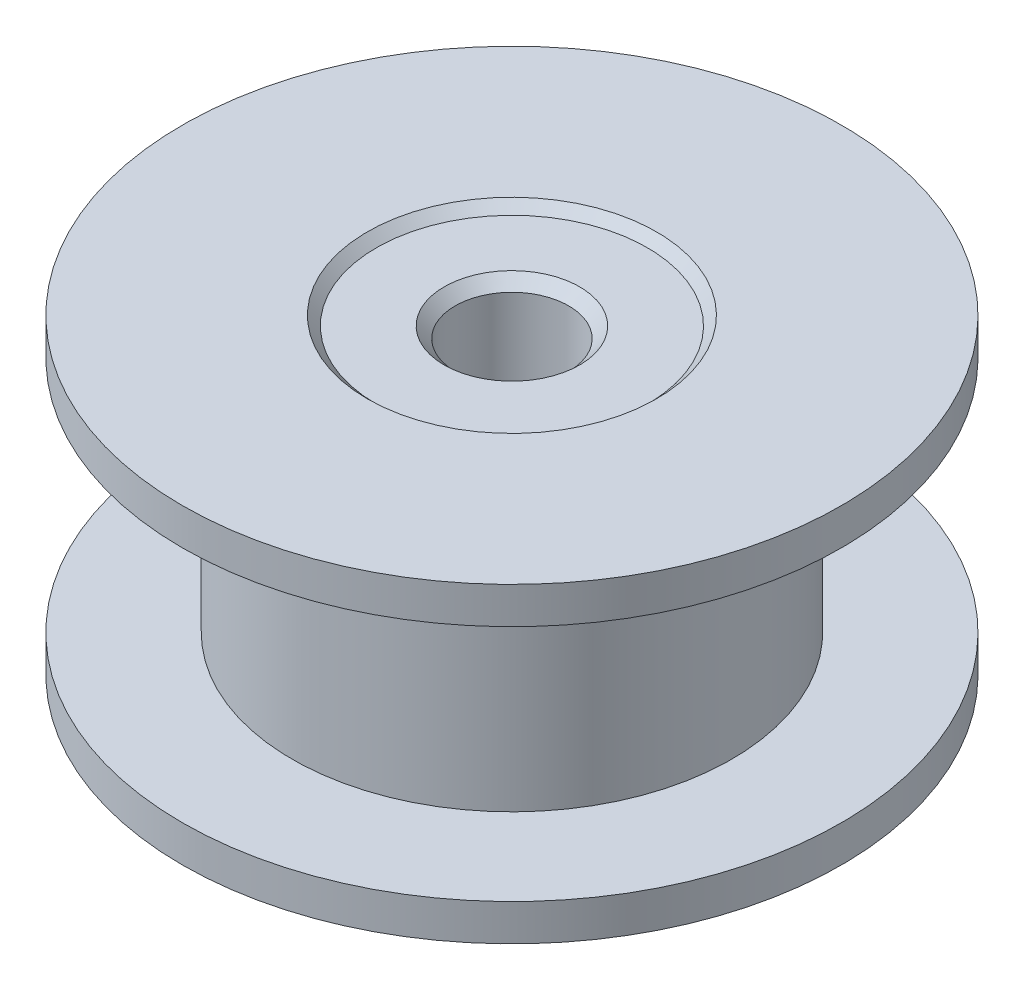
from build123d import *

# Parameters (mm, degrees)
SKETCH1_R           = 6
BOSS_EXTRUDE1_DEPTH = 3.25
SKETCH2_R           = 9
BOSS_EXTRUDE2_DEPTH = 1
SKETCH4_R           = 4
CUT_EXTRUDE1_DEPTH  = 16.305227865
SKETCH7_R           = 4
SKETCH7_R_2         = 1.55
BOSS_EXTRUDE4_DEPTH = 4
CHAMFER2_SIZE       = 0.3


with BuildPart() as part:
    # Sketch1 → Boss-Extrude1 (new, symmetric)
    with BuildSketch(Plane(origin=(0, 0, 0), x_dir=(1, 0, 0), z_dir=(0, 1, 0))):
        with Locations(Location((0, 0, 0), (0, 0, 90))):
            Circle(SKETCH1_R)
    extrude(amount=BOSS_EXTRUDE1_DEPTH, both=True)

    # Sketch2 → Boss-Extrude2 (add)
    with BuildSketch(Plane(origin=(0, 3.25, 0), x_dir=(1, 0, 0), z_dir=(0, 1, 0))):
        with Locations(Location((0, 0, 0), (0, 0, 270))):
            Circle(SKETCH2_R)
    boss_extrude2 = extrude(amount=BOSS_EXTRUDE2_DEPTH)

    # Mirror3: Boss-Extrude2 across plane
    add(boss_extrude2.mirror(Plane.ZX))

    # Sketch4 → Cut-Extrude1 (cut, through all)
    with BuildSketch(Plane.XZ.offset(4.25)):
        with Locations(Location((0, 0, 0), (0, 0, 270))):
            Circle(SKETCH4_R)
    extrude(amount=-CUT_EXTRUDE1_DEPTH, mode=Mode.SUBTRACT)

    # Sketch7 → Boss-Extrude4 (add, symmetric)
    with BuildSketch(Plane(origin=(0, 0, 0), x_dir=(1, 0, 0), z_dir=(0, 1, 0))):
        with Locations(Location((0, 0, 0), (0, 0, 90))):
            Circle(SKETCH7_R)
        with Locations(Location((0, 0, 0), (0, 0, 270))):
            Circle(SKETCH7_R_2, mode=Mode.SUBTRACT)
    extrude(amount=BOSS_EXTRUDE4_DEPTH, both=True)

    # Chamfer2
    # the kernel refuses this chamfer: 0.3 mm, written as the material it adds along each edge
    with BuildSketch(Plane(origin=(0, 4, 0), x_dir=(0, 0, -1), z_dir=(1, 0, 0))) as chamfer2_piece_1_section:
        Polygon((4 - CHAMFER2_SIZE, 0), (4, CHAMFER2_SIZE), (4, 0), align=None)
    chamfer2_piece_1 = revolve(axis=Axis((0, 4, 0), (0, 1, 0)), mode=Mode.PRIVATE)
    chamfer2_piece_1 = split(chamfer2_piece_1, bisect_by=Plane(origin=(0, 4.25, 3.828198445), z_dir=(0, -1, 0)), keep=Keep.TOP, mode=Mode.PRIVATE)
    add(chamfer2_piece_1)
    with BuildSketch(Plane(origin=(0, -4, 0), x_dir=(0, 0, -1), z_dir=(1, 0, 0))) as chamfer2_piece_2_section:
        Polygon((4, -CHAMFER2_SIZE), (4 - CHAMFER2_SIZE, 0), (4, 0), align=None)
    chamfer2_piece_2 = revolve(axis=Axis((0, -4, 0), (0, 1, 0)), mode=Mode.PRIVATE)
    chamfer2_piece_2 = split(chamfer2_piece_2, bisect_by=Plane(origin=(0, -4.25, 3.828198445), z_dir=(0, 1, 0)), keep=Keep.TOP, mode=Mode.PRIVATE)
    add(chamfer2_piece_2)
    # the kernel refuses this chamfer: 0.3 mm, written as the material it takes off along each edge
    with BuildSketch(Plane(origin=(0, 4, 0), x_dir=(0, 0, 1), z_dir=(-1, 0, 0))) as chamfer2_2_piece_1:
        Polygon((1.55, -CHAMFER2_SIZE), (1.55 + CHAMFER2_SIZE, 0), (1.55, 0), align=None)
    revolve(axis=Axis((0, 4, 0), (0, 1, 0)), mode=Mode.SUBTRACT)
    with BuildSketch(Plane(origin=(0, -4, 0), x_dir=(0, 0, 1), z_dir=(-1, 0, 0))) as chamfer2_2_piece_2:
        Polygon((1.55 + CHAMFER2_SIZE, 0), (1.55, CHAMFER2_SIZE), (1.55, 0), align=None)
    revolve(axis=Axis((0, -4, 0), (0, 1, 0)), mode=Mode.SUBTRACT)


solid = part.part
